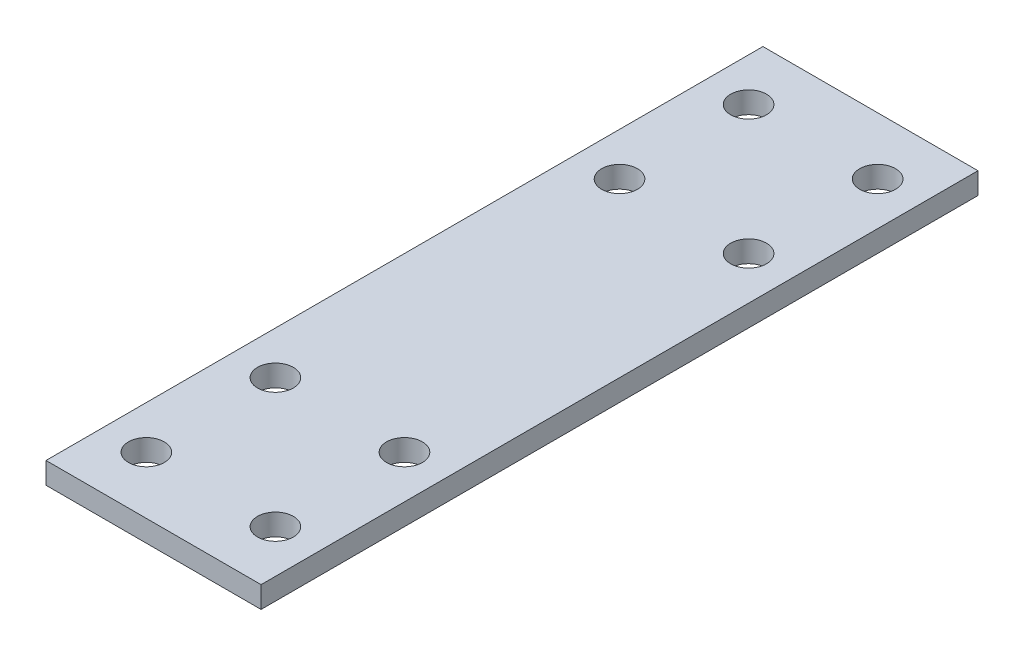
from build123d import *

# Parameters (mm, degrees)
SKETCH1_W           = 30
SKETCH1_H           = 100
SKETCH1_R           = 2.5
BOSS_EXTRUDE1_DEPTH = 3


with BuildPart() as part:
    # Sketch1 → Boss-Extrude1 (new body)
    with BuildSketch(Plane(origin=(0, 0, 0), x_dir=(1, 0, 0), z_dir=(0, 1, 0))):
        with Locations((-7.37923135, -0.005004739)):
            Rectangle(SKETCH1_W, SKETCH1_H)
        with Locations((-16.37923135, -24.005004739)):
            Circle(SKETCH1_R, mode=Mode.SUBTRACT)
        with Locations((1.62076865, -24.005004739)):
            Circle(SKETCH1_R, mode=Mode.SUBTRACT)
        with Locations((1.62076865, -42.005004739)):
            Circle(SKETCH1_R, mode=Mode.SUBTRACT)
        with Locations((-16.37923135, -42.005004739)):
            Circle(SKETCH1_R, mode=Mode.SUBTRACT)
        with Locations((-16.37923135, 41.994995261)):
            Circle(SKETCH1_R, mode=Mode.SUBTRACT)
        with Locations((-16.37923135, 23.994995261)):
            Circle(SKETCH1_R, mode=Mode.SUBTRACT)
        with Locations((1.62076865, 41.994995261)):
            Circle(SKETCH1_R, mode=Mode.SUBTRACT)
        with Locations((1.62076865, 23.994995261)):
            Circle(SKETCH1_R, mode=Mode.SUBTRACT)
    extrude(amount=BOSS_EXTRUDE1_DEPTH)


solid = part.part
